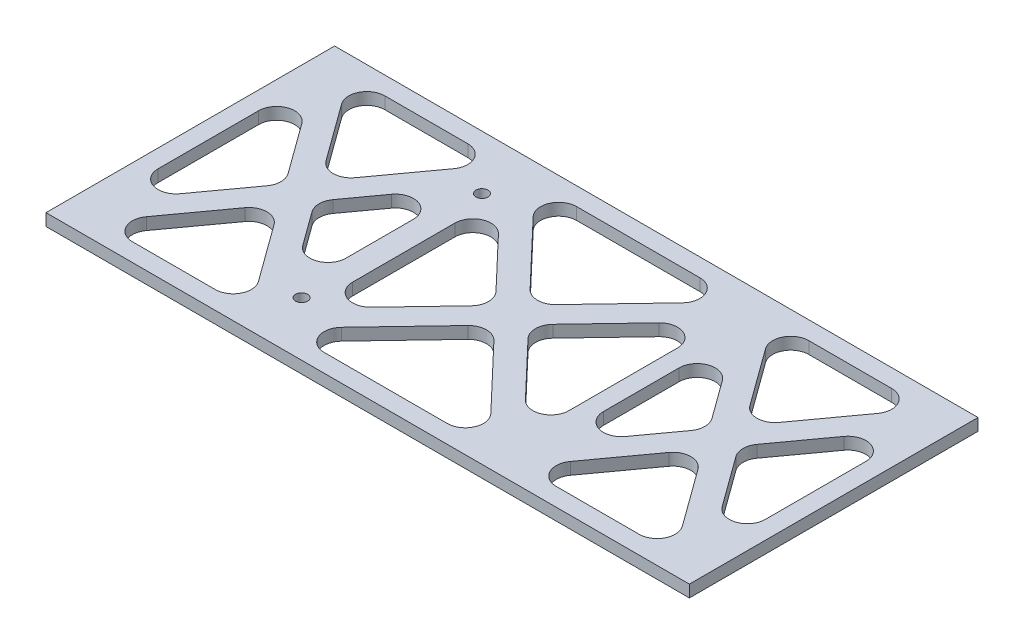
from build123d import *

# Parameters (mm, degrees)
SKETCH1_W           = 271.78
SKETCH1_H           = 121.92
SKETCH1_R           = 2.54
BOSS_EXTRUDE1_DEPTH = 5.08
FILLET1_R           = 7.62


with BuildPart() as part:
    # Sketch1 → Boss-Extrude1 (new body)
    with BuildSketch(Plane(origin=(0, 0, 0), x_dir=(1, 0, 0), z_dir=(0, 1, 0))):
        Rectangle(SKETCH1_W, SKETCH1_H)
        Polygon((121.991825716, -53.34), (57.078174284, -53.34), (89.535, -8.645354751), align=None, mode=Mode.SUBTRACT)
        Polygon((128.27, 44.694645249), (128.27, -44.694645249), (95.813174284, 0), align=None, mode=Mode.SUBTRACT)
        Polygon((57.078174284, 53.34), (121.991825716, 53.34), (89.535, 8.645354751), align=None, mode=Mode.SUBTRACT)
        Polygon((83.256825716, 0), (54.61, -39.448087872), (54.61, 39.448087872), align=None, mode=Mode.SUBTRACT)
        Polygon((43.784761905, -53.34), (-43.784761905, -53.34), (0, -7.366), align=None, mode=Mode.SUBTRACT)
        Polygon((46.99, -41.9735), (7.015238095, 0), (46.99, 41.9735), align=None, mode=Mode.SUBTRACT)
        Polygon((-43.784761905, 53.34), (43.784761905, 53.34), (0, 7.366), align=None, mode=Mode.SUBTRACT)
        Polygon((-7.015238095, 0), (-45.72, -40.64), (-45.72, 40.64), align=None, mode=Mode.SUBTRACT)
        Polygon((-121.991825716, 53.34), (-57.078174284, 53.34), (-89.535, 8.645354751), align=None, mode=Mode.SUBTRACT)
        Polygon((-128.27, -44.694645249), (-128.27, 44.694645249), (-95.813174284, 0), align=None, mode=Mode.SUBTRACT)
        Polygon((-57.078174284, -53.34), (-121.991825716, -53.34), (-89.535, -8.645354751), align=None, mode=Mode.SUBTRACT)
        Polygon((-55.88, -37.699235413), (-83.256825716, 0), (-55.88, 37.699235413), align=None, mode=Mode.SUBTRACT)
        with Locations((-50.8, -38.1)):
            Circle(SKETCH1_R, mode=Mode.SUBTRACT)
        with Locations((-50.8, 38.1)):
            Circle(SKETCH1_R, mode=Mode.SUBTRACT)
    extrude(amount=BOSS_EXTRUDE1_DEPTH)

    # Fillet1
    fillet1_edges = [part.edges().sort_by_distance(p)[0] for p in [
        (54.61, 2.54, 39.448087872),
        (89.535, 2.54, -8.645354751),
        (0, 2.54, -7.366),
        (-55.88, 2.54, -37.699235413),
        (-121.991825716, 2.54, -53.34),
        (-43.784761905, 2.54, -53.34),
        (-45.72, 2.54, 40.64),
        (-55.88, 2.54, 37.699235413),
        (-89.535, 2.54, -8.645354751),
        (-89.535, 2.54, 8.645354751),
        (0, 2.54, 7.366),
        (89.535, 2.54, 8.645354751),
        (128.27, 2.54, -44.694645249),
        (57.078174284, 2.54, -53.34),
        (54.61, 2.54, -39.448087872),
        (46.99, 2.54, -41.9735),
        (-45.72, 2.54, -40.64),
        (46.99, 2.54, 41.9735),
        (-83.256825716, 2.54, 0),
        (95.813174284, 2.54, 0),
        (7.015238095, 2.54, 0),
        (-43.784761905, 2.54, 53.34),
        (-121.991825716, 2.54, 53.34),
        (57.078174284, 2.54, 53.34),
        (128.27, 2.54, 44.694645249),
        (121.991825716, 2.54, 53.34),
        (-57.078174284, 2.54, 53.34),
        (43.784761905, 2.54, 53.34),
        (-7.015238095, 2.54, 0),
        (83.256825716, 2.54, 0),
        (121.991825716, 2.54, -53.34),
        (43.784761905, 2.54, -53.34),
        (-57.078174284, 2.54, -53.34),
        (-95.813174284, 2.54, 0),
        (-128.27, 2.54, 44.694645249),
        (-128.27, 2.54, -44.694645249),
    ]]
    fillet(fillet1_edges, radius=FILLET1_R)


solid = part.part
